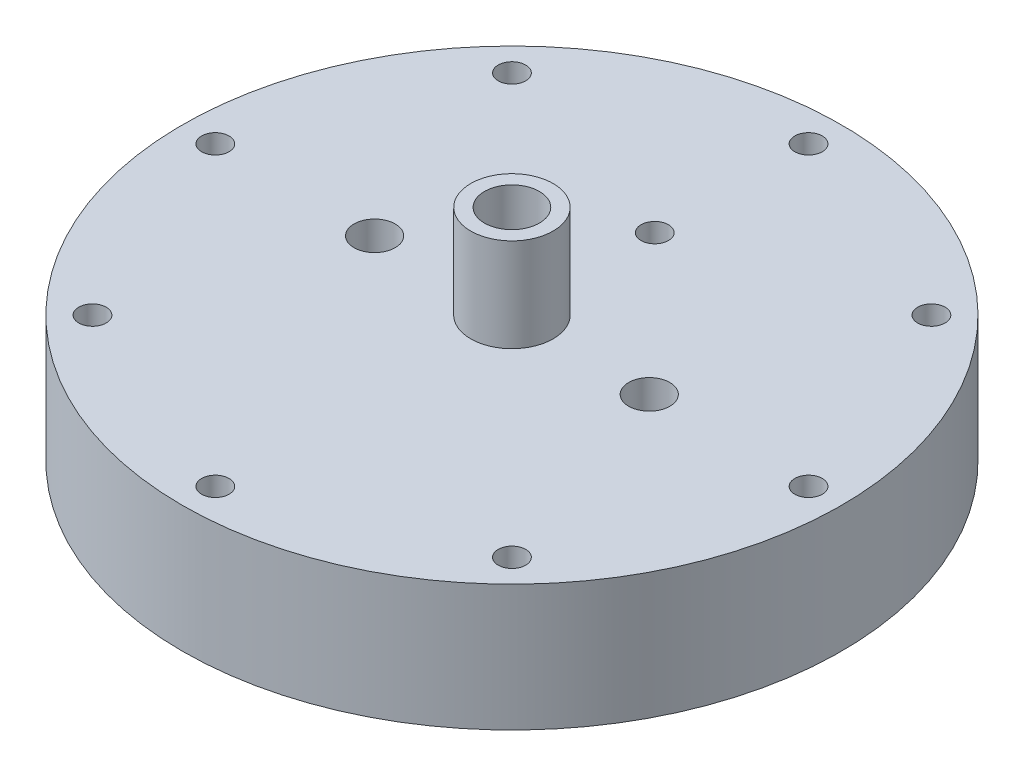
from build123d import *

# Parameters (mm, degrees)
SKETCH1_R             = 76.2
BILLET_DEPTH          = 50.8
SKETCH3_R             = 19.05
LOX_PLATE_DEPTH       = 13.97
SKETCH5_R             = 13.97
LOX_DOME_DEPTH        = 20.32
SKETCH6_R             = 6.35
LOX_INLET_DEPTH       = 50.8
F_1_4_BOLT_HOLE_REACH = 121.137
SKETCH11_R            = 3.175
BOLT_PATTERN_COUNT    = 8
SKETCH7_R             = 76.2
SKETCH7_R_2           = 9.525
TOP_MILL_DEPTH        = 21.59
SKETCH12_R            = 57.15
KEROSENE_PLATE_DEPTH  = 10.16
KEROSENE_INLET_REACH  = 121.137
SKETCH13_R            = 4.7625
MANIFOLD_HOLE_REACH   = 121.137
SKETCH14_R            = 3.175
SKETCH15_R            = 10.16
SKETCH15_R_2          = 7.62
MANIFOLD_SEAL_DEPTH   = 12.192
SKETCH16_R            = 17.78
SKETCH16_R_2          = 16.51
LOX_SEAL_DEPTH        = 16.002


with BuildPart() as part:
    # Sketch1 → Billet (new body)
    with BuildSketch(Plane(origin=(0, 0, 0), x_dir=(1, 0, 0), z_dir=(0, 1, 0))):
        Circle(SKETCH1_R)
    extrude(amount=-BILLET_DEPTH)

    # Sketch3 → Lox Plate (cut)
    with BuildSketch(Plane(origin=(0, -50.8, 0), x_dir=(1, 0, 0), z_dir=(0, 1, 0))):
        Circle(SKETCH3_R)
    extrude(amount=LOX_PLATE_DEPTH, mode=Mode.SUBTRACT)

    # Sketch5 → Lox Dome (cut)
    with BuildSketch(Plane(origin=(0, -50.8, 0), x_dir=(1, 0, 0), z_dir=(0, 1, 0))):
        Circle(SKETCH5_R)
    extrude(amount=LOX_DOME_DEPTH, mode=Mode.SUBTRACT)

    # Sketch6 → Lox Inlet (cut)
    with BuildSketch(Plane(origin=(0, -50.8, 0), x_dir=(1, 0, 0), z_dir=(0, 1, 0))):
        Circle(SKETCH6_R)
    extrude(amount=LOX_INLET_DEPTH, mode=Mode.SUBTRACT)

    # Sketch11 → 1/4" Bolt Hole (cut, up to next)
    with BuildSketch(Plane(origin=(0, -50.8, 0), x_dir=(1, 0, 0), z_dir=(0, 1, 0)), mode=Mode.PRIVATE) as f_1_4_bolt_hole_sk1:
        with Locations((0, 68.58)):
            Circle(SKETCH11_R)
    f_1_4_bolt_hole_tool1 = extrude(f_1_4_bolt_hole_sk1.sketch, amount=F_1_4_BOLT_HOLE_REACH, mode=Mode.PRIVATE) & part.part
    f_1_4_bolt_hole = f_1_4_bolt_hole_tool1.solids().sort_by_distance((0, -50.8, -68.58))[0]
    add(f_1_4_bolt_hole, mode=Mode.SUBTRACT)

    # Bolt Pattern: 1/4" Bolt Hole ×8 about axis
    bolt_pattern_axis = Axis((0, 53.34, 0), (0, -1, 0))
    for i in range(1, BOLT_PATTERN_COUNT):
        add(f_1_4_bolt_hole.rotate(bolt_pattern_axis, i * 360 / BOLT_PATTERN_COUNT), mode=Mode.SUBTRACT)

    # Sketch7 → Top Mill (cut)
    with BuildSketch(Plane(origin=(0, 0, 0), x_dir=(1, 0, 0), z_dir=(0, 1, 0))):
        Circle(SKETCH7_R)
        Circle(SKETCH7_R_2, mode=Mode.SUBTRACT)
    extrude(amount=-TOP_MILL_DEPTH, mode=Mode.SUBTRACT)

    # Sketch12 → Kerosene Plate (cut)
    with BuildSketch(Plane(origin=(0, -50.8, 0), x_dir=(1, 0, 0), z_dir=(0, 1, 0))):
        Circle(SKETCH12_R)
    extrude(amount=KEROSENE_PLATE_DEPTH, mode=Mode.SUBTRACT)

    # Sketch13 → Kerosene Inlet (cut, up to next)
    with BuildSketch(Plane(origin=(0, 0, 0), x_dir=(1, 0, 0), z_dir=(0, 1, 0)), mode=Mode.PRIVATE) as kerosene_inlet_sk1:
        with Locations((-31.75, 0)):
            Circle(SKETCH13_R)
    kerosene_inlet_tool1 = extrude(kerosene_inlet_sk1.sketch, amount=-KEROSENE_INLET_REACH, mode=Mode.PRIVATE) & part.part
    # Sketch13 → Kerosene Inlet (cut, up to next)
    with BuildSketch(Plane(origin=(0, 0, 0), x_dir=(1, 0, 0), z_dir=(0, 1, 0)), mode=Mode.PRIVATE) as kerosene_inlet_sk2:
        with Locations((31.75, 0)):
            Circle(SKETCH13_R)
    kerosene_inlet_tool2 = extrude(kerosene_inlet_sk2.sketch, amount=-KEROSENE_INLET_REACH, mode=Mode.PRIVATE) & part.part
    add(kerosene_inlet_tool1.solids().sort_by_distance((-31.75, 0, 0))[0], mode=Mode.SUBTRACT)
    add(kerosene_inlet_tool2.solids().sort_by_distance((31.75, 0, 0))[0], mode=Mode.SUBTRACT)

    # Sketch14 → Manifold hole (cut, up to next)
    with BuildSketch(Plane(origin=(0, 0, 0), x_dir=(1, 0, 0), z_dir=(0, 1, 0)), mode=Mode.PRIVATE) as manifold_hole_sk1:
        with Locations((0, 33.02)):
            Circle(SKETCH14_R)
    manifold_hole_tool1 = extrude(manifold_hole_sk1.sketch, amount=-MANIFOLD_HOLE_REACH, mode=Mode.PRIVATE) & part.part
    add(manifold_hole_tool1.solids().sort_by_distance((0, 0, -33.02))[0], mode=Mode.SUBTRACT)

    # Sketch15 → Manifold seal (cut)
    with BuildSketch(Plane(origin=(0, -50.8, 0), x_dir=(1, 0, 0), z_dir=(0, 1, 0))):
        with Locations((0, 33.02)):
            Circle(SKETCH15_R)
        with Locations((0, 33.02)):
            Circle(SKETCH15_R_2, mode=Mode.SUBTRACT)
    extrude(amount=MANIFOLD_SEAL_DEPTH, mode=Mode.SUBTRACT)

    # Sketch16 → Lox seal (cut)
    with BuildSketch(Plane(origin=(0, -50.8, 0), x_dir=(1, 0, 0), z_dir=(0, 1, 0))):
        Circle(SKETCH16_R)
        Circle(SKETCH16_R_2, mode=Mode.SUBTRACT)
    extrude(amount=LOX_SEAL_DEPTH, mode=Mode.SUBTRACT)


solid = part.part
